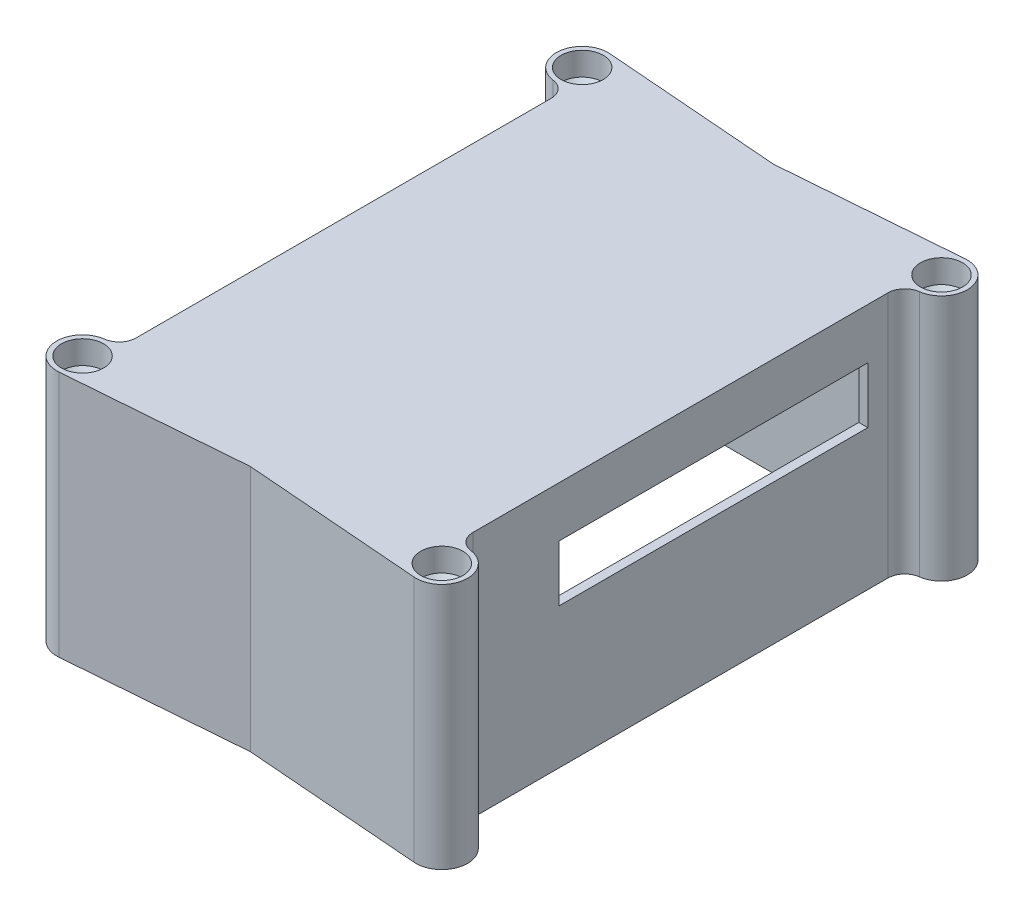
from build123d import *

# Parameters (mm, degrees)
BASE_DEPTH                               = 9
BASE_DEPTH_BACK                          = 35
SKETCH1_W                                = 60
SKETCH1_H                                = 89
OUTSIDE_OF_BASE_R                        = 3
INSIDE_OF_BASE_T                         = -1.6
TOP_START                                = -44
TOP_FASTENING_BODY_DEPTH                 = 44
CBORE_FOR_M4_SHCS1_D                     = 4.8
CBORE_FOR_M4_SHCS1_CBORE_D               = 7.5
CBORE_FOR_M4_SHCS1_CBORE_DEPTH           = 4
TFB_START                                = -44
TFB_M_V_COPY_1_DEPTH                     = 44
TFB_M_V_COPY_2_D                         = 4.8
TFB_M_V_COPY_2_CBORE_D                   = 7.5
TFB_M_V_COPY_2_CBORE_DEPTH               = 4
SKETCH12_W                               = 8.4
SKETCH12_H                               = 3.5
MICROUSB_DEPTH                           = 1.6
F_3D_PRINTING_FOR_FASTENING_FEATURE_SIZE = 1.5
TFB_OUTER_R                              = 3
SKETCH28_W                               = 55
SKETCH28_H                               = 10
CUT_EXTRUDE1_DEPTH                       = 10


with BuildPart() as part:
    # Sketch1 → BASE (new, two sides: drawn at the far end of the back side and taken through both)
    with BuildSketch(Plane(origin=(0, 0, 0), x_dir=(1, 0, 0), z_dir=(0, 1, 0)).offset(-BASE_DEPTH_BACK)):
        Rectangle(SKETCH1_W, SKETCH1_H)
    extrude(amount=BASE_DEPTH + BASE_DEPTH_BACK)

    # OUTSIDE OF BASE
    outside_of_base_edges = [part.edges().sort_by_distance(p)[0] for p in [
        (30, -13, 44.5),
        (-30, -13, 44.5),
        (-30, -13, -44.5),
        (30, -13, -44.5),
    ]]
    fillet(outside_of_base_edges, radius=OUTSIDE_OF_BASE_R)

    # INSIDE OF BASE
    inside_of_base_openings = [part.faces().sort_by_distance(p)[0] for p in [
        (0, -35, 0),
    ]]
    offset(amount=INSIDE_OF_BASE_T, openings=inside_of_base_openings, kind=Kind.INTERSECTION)

    # Sketch22 → TOP FASTENING BODY (add)
    with BuildSketch(Plane.XZ.offset(35).offset(TOP_START)):
        with BuildLine():
            Line((-31.641355932, 49.085997649), (27, 44.5))
            Line((27, 44.5), (-27, 44.5))
            ThreePointArc((-27, 44.5), (-29.121320344, 43.621320344), (-30, 41.5))
            Line((-30, 41.5), (-30, 39.729546587))
            Line((-30, 39.729546587), (-32.358644068, 39.914002351))
            ThreePointArc((-32.358644068, 39.914002351), (-36.585997649, 44.858644068), (-31.641355932, 49.085997649))
        make_face()
    top_fastening_body = extrude(amount=TOP_FASTENING_BODY_DEPTH)

    # CBORE for M4 SHCS1 (through all)
    with Locations(Plane(origin=(0, 9, 0), x_dir=(1, 0, 0), z_dir=(0, 1, 0))):
        with Locations((-32, -44.5)):
            cbore_for_m4_shcs1 = CounterBoreHole(CBORE_FOR_M4_SHCS1_D / 2, CBORE_FOR_M4_SHCS1_CBORE_D / 2, CBORE_FOR_M4_SHCS1_CBORE_DEPTH)

    # TFB M H: TOP FASTENING BODY, CBORE for M4 SHCS1 across plane
    add(top_fastening_body.mirror(Plane(origin=(0, 0, 0), x_dir=(0, 0, 1), z_dir=(1, 0, 0))))
    add(cbore_for_m4_shcs1.mirror(Plane(origin=(0, 0, 0), x_dir=(0, 0, 1), z_dir=(1, 0, 0))), mode=Mode.SUBTRACT)

    # TFB M V: TOP FASTENING BODY, CBORE for M4 SHCS1 across plane
    add(top_fastening_body.mirror(Plane.XY))
    add(cbore_for_m4_shcs1.mirror(Plane.XY), mode=Mode.SUBTRACT)

    # TFB M V copy 1 sketch → TFB M V copy 1 (add)
    with BuildSketch(Plane(origin=(0, -35, 0), x_dir=(-1, 0, 0), z_dir=(0, -1, 0)).offset(TFB_START)):
        with BuildLine():
            Line((-31.641355932, 49.085997649), (27, 44.5))
            Line((27, 44.5), (-27, 44.5))
            ThreePointArc((-27, 44.5), (-29.121320344, 43.621320344), (-30, 41.5))
            Line((-30, 41.5), (-30, 39.729546587))
            Line((-30, 39.729546587), (-32.358644068, 39.914002351))
            ThreePointArc((-32.358644068, 39.914002351), (-36.585997649, 44.858644068), (-31.641355932, 49.085997649))
        make_face()
    extrude(amount=TFB_M_V_COPY_1_DEPTH)

    # TFB M V copy 2 (through all)
    with Locations(Plane(origin=(0, 9, 0), x_dir=(-1, 0, 0), z_dir=(0, 1, 0))):
        with Locations((-32, -44.5)):
            CounterBoreHole(TFB_M_V_COPY_2_D / 2, TFB_M_V_COPY_2_CBORE_D / 2, TFB_M_V_COPY_2_CBORE_DEPTH)

    # Sketch12 → MICROUSB (cut)
    with BuildSketch(Plane.ZY.offset(30)):
        with Locations((-31.9, -33.25)):
            Rectangle(SKETCH12_W, SKETCH12_H)
    extrude(amount=-MICROUSB_DEPTH, mode=Mode.SUBTRACT)

    # 3D PRINTING FOR FASTENING FEATURE
    # the kernel refuses this chamfer: 1.5 mm, written as the material it takes off along each edge
    with BuildSketch(Plane(origin=(32, 5, 44.5), x_dir=(1, 0, 0), z_dir=(0, 0, 1))) as f_3d_printing_for_fastening_feature_piece_1_section:
        Polygon((2.4 + F_3D_PRINTING_FOR_FASTENING_FEATURE_SIZE, 0), (2.4, -F_3D_PRINTING_FOR_FASTENING_FEATURE_SIZE), (2.4, 0), align=None)
    f_3d_printing_for_fastening_feature_piece_1 = revolve(axis=Axis((32, 5, 44.5), (0, 1, 0)), mode=Mode.PRIVATE)
    f_3d_printing_for_fastening_feature_piece_1 = f_3d_printing_for_fastening_feature_piece_1 & Plane(origin=(32, 4.173590616, 44.5), x_dir=(-1, 0, 0), z_dir=(0, 1, 0)) * Cylinder(3.75, 16, mode=Mode.PRIVATE)
    add(f_3d_printing_for_fastening_feature_piece_1, mode=Mode.SUBTRACT)
    with BuildSketch(Plane(origin=(32, 5, -44.5), x_dir=(1, 0, 0), z_dir=(0, 0, -1))) as f_3d_printing_for_fastening_feature_piece_2_section:
        Polygon((2.4 + F_3D_PRINTING_FOR_FASTENING_FEATURE_SIZE, 0), (2.4, F_3D_PRINTING_FOR_FASTENING_FEATURE_SIZE), (2.4, 0), align=None)
    f_3d_printing_for_fastening_feature_piece_2 = revolve(axis=Axis((32, 5, -44.5), (0, -1, 0)), mode=Mode.PRIVATE)
    f_3d_printing_for_fastening_feature_piece_2 = f_3d_printing_for_fastening_feature_piece_2 & Plane(origin=(32, 4.173590616, -44.5), x_dir=(-1, 0, 0), z_dir=(0, 1, 0)) * Cylinder(3.75, 16, mode=Mode.PRIVATE)
    add(f_3d_printing_for_fastening_feature_piece_2, mode=Mode.SUBTRACT)
    with BuildSketch(Plane(origin=(-32, 5, -44.5), x_dir=(-1, 0, 0), z_dir=(0, 0, -1))) as f_3d_printing_for_fastening_feature_piece_3_section:
        Polygon((2.4 + F_3D_PRINTING_FOR_FASTENING_FEATURE_SIZE, 0), (2.4, -F_3D_PRINTING_FOR_FASTENING_FEATURE_SIZE), (2.4, 0), align=None)
    f_3d_printing_for_fastening_feature_piece_3 = revolve(axis=Axis((-32, 5, -44.5), (0, 1, 0)), mode=Mode.PRIVATE)
    f_3d_printing_for_fastening_feature_piece_3 = f_3d_printing_for_fastening_feature_piece_3 & Plane(origin=(-32, 4.173590616, -44.5), x_dir=(1, 0, 0), z_dir=(0, 1, 0)) * Cylinder(3.75, 16, mode=Mode.PRIVATE)
    add(f_3d_printing_for_fastening_feature_piece_3, mode=Mode.SUBTRACT)
    with BuildSketch(Plane(origin=(-32, 5, 44.5), x_dir=(-1, 0, 0), z_dir=(0, 0, 1))) as f_3d_printing_for_fastening_feature_piece_4_section:
        Polygon((2.4 + F_3D_PRINTING_FOR_FASTENING_FEATURE_SIZE, 0), (2.4, F_3D_PRINTING_FOR_FASTENING_FEATURE_SIZE), (2.4, 0), align=None)
    f_3d_printing_for_fastening_feature_piece_4 = revolve(axis=Axis((-32, 5, 44.5), (0, -1, 0)), mode=Mode.PRIVATE)
    f_3d_printing_for_fastening_feature_piece_4 = f_3d_printing_for_fastening_feature_piece_4 & Plane(origin=(-32, 4.173590616, 44.5), x_dir=(1, 0, 0), z_dir=(0, 1, 0)) * Cylinder(3.75, 16, mode=Mode.PRIVATE)
    add(f_3d_printing_for_fastening_feature_piece_4, mode=Mode.SUBTRACT)

    # TFB OUTER
    tfb_outer_edges = [part.edges().sort_by_distance(p)[0] for p in [
        (30, -13, 39.729546587),
        (30, -13, -39.729546587),
        (-30, -13, -39.729546587),
        (-30, -13, 39.729546587),
    ]]
    fillet(tfb_outer_edges, radius=TFB_OUTER_R)

    # Sketch28 → Cut-Extrude1 (cut)
    with BuildSketch(Plane(origin=(30, 0, 0), x_dir=(0, 0, -1), z_dir=(1, 0, 0))):
        with Locations((5.877935747, -5)):
            Rectangle(SKETCH28_W, SKETCH28_H)
    extrude(amount=-CUT_EXTRUDE1_DEPTH, mode=Mode.SUBTRACT)


solid = part.part
